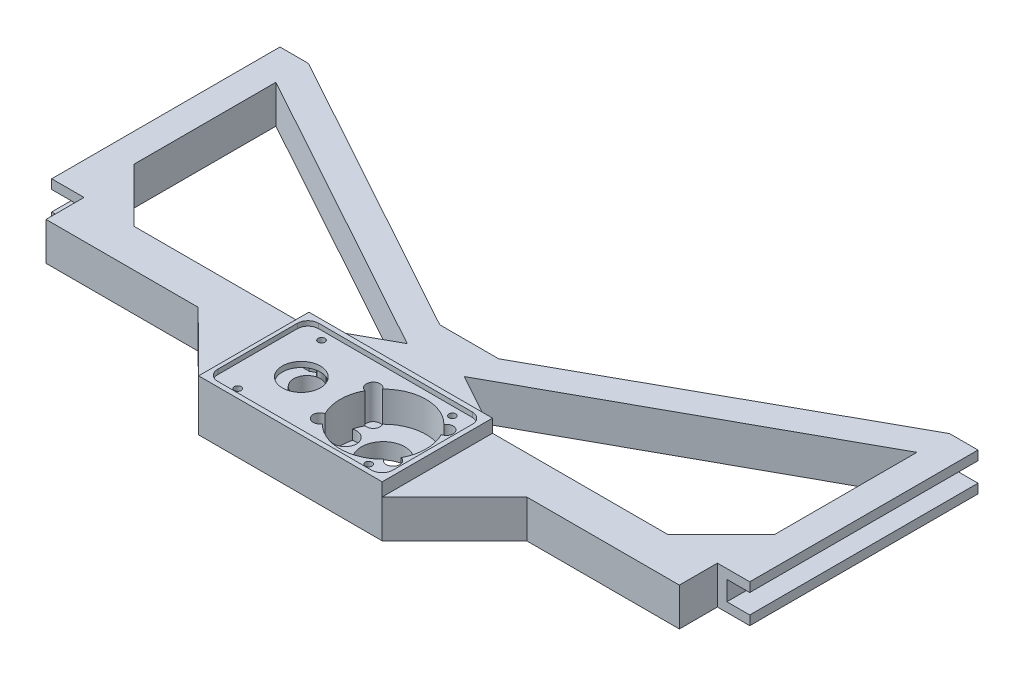
from build123d import *

# Parameters (mm, degrees)
BOSS_EXTRUDE1_DEPTH   = 12.7
CUT_EXTRUDE1_DEPTH    = 246.515176771
SKETCH3_W             = 7.62
SKETCH3_H             = 6.477
CUT_EXTRUDE2_DEPTH    = 246.515176771
SKETCH6_W             = 61.2775
SKETCH6_H             = 36.83
BOSS_EXTRUDE2_DEPTH   = 4.3815
CAVITY1_START         = 5.334
CAVITY1_OUTLINE_R     = 1.143
CAVITY1_OUTLINE_R_2   = 4.445
CAVITY1_DEPTH         = 11.7475
CAVITY1_START_2       = 15.494
CAVITY1_2_OUTLINE_R   = 1.143
CAVITY1_2_OUTLINE_R_2 = 4.445
CAVITY1_2_DEPTH       = 1.5875
CAVITY1_3_OUTLINE_R   = 1.143
CAVITY1_3_OUTLINE_R_2 = 7.239
CAVITY1_3_DEPTH       = 5.334
CAVITY1_START_3       = 2.286
CAVITY1_4_OUTLINE_R   = 4.445
CAVITY1_4_DEPTH       = 3.048
CAVITY1_START_4       = 13.716
CAVITY1_5_DEPTH       = 1.778
CAVITY1_6_OUTLINE_R   = 1.905
CAVITY1_6_OUTLINE_R_2 = 1.143
CAVITY1_6_DEPTH       = 3.302
CAVITY1_START_5       = 4.064
CAVITY1_7_OUTLINE_R   = 2.286
CAVITY1_7_DEPTH       = 1.27
CAVITY1_START_6       = 2.032
CAVITY1_8_DEPTH       = 0.254
SKETCH7_R             = 2.286
CUT_EXTRUDE4_DEPTH    = 10.795


# Read off the part's stored shape, not the designer's step: Cavity1
with BuildPart() as part:
    # Sketch1 → Boss-Extrude1 (new body)
    with BuildSketch(Plane(origin=(0, 0, 0), x_dir=(1, 0, 0), z_dir=(0, 1, 0))):
        Polygon((-233.045, 0), (-222.25, 0), (-222.25, -12.7), (-171.45, -12.7), (-147.16125, -36.83), (-85.88375, -36.83), (-61.595, -12.7), (-10.795, -12.7), (-10.795, 0), (0, 0), (0, 76.2), (-233.045, 76.2), align=None)
    extrude(amount=BOSS_EXTRUDE1_DEPTH)

    # Sketch2 → Cut-Extrude1 (cut, through all)
    with BuildSketch(Plane(origin=(0, 12.7, 0), x_dir=(1, 0, 0), z_dir=(0, 1, 0))):
        Polygon((-223.52, 76.2), (-9.525, 76.2), (-106.410006281, 22.561242197), (-126.0475, 22.561242197), align=None)
        Polygon((-223.52, 65.328031159), (-223.52, 17.960512242), (-205.559487758, 0), (-147.16125, 0), (-126.0475, 11.689273356), align=None)
        Polygon((-85.88375, 0), (-106.9975, 11.689273356), (-9.525, 65.328031159), (-9.525, 17.960512242), (-27.485512242, 0), align=None)
    extrude(amount=-CUT_EXTRUDE1_DEPTH, mode=Mode.SUBTRACT)

    # Sketch3 → Cut-Extrude2 (cut, through all)
    with BuildSketch(Plane.XY):
        with Locations((-229.235, 6.35)):
            Rectangle(SKETCH3_W, SKETCH3_H)
    cut_extrude2 = extrude(amount=-CUT_EXTRUDE2_DEPTH, mode=Mode.SUBTRACT)

    # Mirror1: Cut-Extrude2 across plane
    add(cut_extrude2.mirror(Plane.ZY.offset(116.5225)), mode=Mode.SUBTRACT)

    # Sketch6 → Boss-Extrude2 (add)
    with BuildSketch(Plane.XZ.offset(-12.7)):
        with Locations((-116.5225, 18.415)):
            Rectangle(SKETCH6_W, SKETCH6_H)
    extrude(amount=-BOSS_EXTRUDE2_DEPTH)

    # Cavity1 outline → Cavity1 (cut)
    with BuildSketch(Plane(origin=(0, 0, 0), x_dir=(1, 0, 0), z_dir=(0, 1, 0)).offset(CAVITY1_START)):
        with Locations((-138.52525, -4.445)):
            Circle(CAVITY1_OUTLINE_R)
        with Locations((-129.38125, -18.415)):
            Circle(CAVITY1_OUTLINE_R_2)
        with BuildLine():
            ThreePointArc((-116.691438518, -11.751494253), (-118.33225, -18.415), (-116.691438518, -25.078505747))
            ThreePointArc((-116.691438518, -25.078505747), (-118.020355214, -28.651847552), (-114.211817504, -28.479128852))
            ThreePointArc((-114.211817504, -28.479128852), (-103.98125, -32.766), (-93.750682496, -28.479128852))
            ThreePointArc((-93.750682496, -28.479128852), (-89.942144786, -28.651847552), (-91.271061482, -25.078505747))
            ThreePointArc((-91.271061482, -25.078505747), (-89.63025, -18.415), (-91.271061482, -11.751494253))
            ThreePointArc((-91.271061482, -11.751494253), (-89.942144786, -8.178152448), (-93.750682496, -8.350871148))
            ThreePointArc((-93.750682496, -8.350871148), (-103.98125, -4.064), (-114.211817504, -8.350871148))
            ThreePointArc((-114.211817504, -8.350871148), (-118.020355214, -8.178152448), (-116.691438518, -11.751494253))
        make_face()
        with Locations((-94.83725, -4.445)):
            Circle(CAVITY1_OUTLINE_R)
        with Locations((-138.52525, -32.385)):
            Circle(CAVITY1_OUTLINE_R)
        with Locations((-94.83725, -32.385)):
            Circle(CAVITY1_OUTLINE_R)
    extrude(amount=CAVITY1_DEPTH, mode=Mode.SUBTRACT)

    # Cavity1 2 outline → Cavity1 2 (cut)
    with BuildSketch(Plane(origin=(0, 0, 0), x_dir=(1, 0, 0), z_dir=(0, 1, 0)).offset(CAVITY1_START_2)):
        with BuildLine():
            ThreePointArc((-142.33525, -1.5875), (-144.849721714, -2.629028286), (-145.89125, -5.1435))
            Line((-145.89125, -5.1435), (-145.89125, -31.6865))
            ThreePointArc((-145.89125, -31.6865), (-144.849721714, -34.200971714), (-142.33525, -35.2425))
            Line((-142.33525, -35.2425), (-91.02725, -35.2425))
            ThreePointArc((-91.02725, -35.2425), (-88.512778286, -34.200971714), (-87.47125, -31.6865))
            Line((-87.47125, -31.6865), (-87.47125, -5.1435))
            ThreePointArc((-87.47125, -5.1435), (-88.512778286, -2.629028286), (-91.02725, -1.5875))
            Line((-91.02725, -1.5875), (-142.33525, -1.5875))
        make_face()
        with Locations((-138.52525, -4.445)):
            Circle(CAVITY1_2_OUTLINE_R, mode=Mode.SUBTRACT)
        with BuildLine():
            ThreePointArc((-114.211817504, -8.350871148), (-103.98125, -4.064), (-93.750682496, -8.350871148))
            ThreePointArc((-93.750682496, -8.350871148), (-89.942144786, -8.178152448), (-91.271061482, -11.751494253))
            ThreePointArc((-91.271061482, -11.751494253), (-89.63025, -18.415), (-91.271061482, -25.078505747))
            ThreePointArc((-91.271061482, -25.078505747), (-89.942144786, -28.651847552), (-93.750682496, -28.479128852))
            ThreePointArc((-93.750682496, -28.479128852), (-103.98125, -32.766), (-114.211817504, -28.479128852))
            ThreePointArc((-114.211817504, -28.479128852), (-118.020355214, -28.651847552), (-116.691438518, -25.078505747))
            ThreePointArc((-116.691438518, -25.078505747), (-118.33225, -18.415), (-116.691438518, -11.751494253))
            ThreePointArc((-116.691438518, -11.751494253), (-118.020355214, -8.178152448), (-114.211817504, -8.350871148))
        make_face(mode=Mode.SUBTRACT)
        with Locations((-129.38125, -18.415)):
            Circle(CAVITY1_2_OUTLINE_R_2, mode=Mode.SUBTRACT)
        with Locations((-94.83725, -4.445)):
            Circle(CAVITY1_2_OUTLINE_R, mode=Mode.SUBTRACT)
        with Locations((-138.52525, -32.385)):
            Circle(CAVITY1_2_OUTLINE_R, mode=Mode.SUBTRACT)
        with Locations((-94.83725, -32.385)):
            Circle(CAVITY1_2_OUTLINE_R, mode=Mode.SUBTRACT)
    extrude(amount=CAVITY1_2_DEPTH, mode=Mode.SUBTRACT)

    # Cavity1 3 outline → Cavity1 3 (cut)
    with BuildSketch(Plane(origin=(0, 0, 0), x_dir=(1, 0, 0), z_dir=(0, 1, 0))):
        with Locations((-138.52525, -4.445)):
            Circle(CAVITY1_3_OUTLINE_R)
        with Locations((-94.83725, -4.445)):
            Circle(CAVITY1_3_OUTLINE_R)
        with Locations((-138.52525, -32.385)):
            Circle(CAVITY1_3_OUTLINE_R)
        with Locations((-94.83725, -32.385)):
            Circle(CAVITY1_3_OUTLINE_R)
        with Locations((-103.98125, -18.415)):
            Circle(CAVITY1_3_OUTLINE_R_2)
    extrude(amount=CAVITY1_3_DEPTH, mode=Mode.SUBTRACT)

    # Cavity1 4 outline → Cavity1 4 (cut)
    with BuildSketch(Plane(origin=(0, 0, 0), x_dir=(1, 0, 0), z_dir=(0, 1, 0)).offset(CAVITY1_START_3)):
        with Locations((-129.38125, -18.415)):
            Circle(CAVITY1_4_OUTLINE_R)
        with BuildLine():
            ThreePointArc((-117.868065, -22.03543784), (-112.87125, -18.415), (-117.868065, -14.79456216))
            ThreePointArc((-117.868065, -14.79456216), (-118.33225, -18.415), (-117.868065, -22.03543784))
        make_face()
    extrude(amount=CAVITY1_4_DEPTH, mode=Mode.SUBTRACT)

    # Cavity1 5 outline → Cavity1 5 (cut)
    with BuildSketch(Plane(origin=(0, 0, 0), x_dir=(1, 0, 0), z_dir=(0, 1, 0)).offset(CAVITY1_START_4)):
        with BuildLine():
            Line((-128.370308668, -14.08648725), (-130.279975967, -12.145238237))
            ThreePointArc((-130.279975967, -12.145238237), (-134.269599777, -12.809455949), (-137.048919641, -15.747765737))
            Line((-137.048919641, -15.747765737), (-133.557318942, -16.89234666))
            ThreePointArc((-133.557318942, -16.89234666), (-131.4961306, -14.505357427), (-128.370308668, -14.08648725))
        make_face()
        with BuildLine():
            ThreePointArc((-125.062898336, -17.153099029), (-126.88891679, -13.833956381), (-130.279975967, -12.145238237))
            Line((-130.279975967, -12.145238237), (-128.370308668, -14.08648725))
            ThreePointArc((-128.370308668, -14.08648725), (-126.324912496, -15.187489185), (-125.114191907, -17.169913564))
            Line((-125.114191907, -17.169913564), (-125.062898336, -17.153099029))
        make_face()
        with BuildLine():
            ThreePointArc((-125.000827582, -17.511692175), (-125.02929351, -17.331950842), (-125.062898336, -17.153099029))
            Line((-125.062898336, -17.153099029), (-125.114191907, -17.169913564))
            ThreePointArc((-125.114191907, -17.169913564), (-125.072760846, -17.321864049), (-125.036738936, -17.475186925))
            Line((-125.036738936, -17.475186925), (-125.000827582, -17.511692175))
        make_face()
        with BuildLine():
            Line((-133.557318942, -16.89234666), (-137.048919641, -15.747765737))
            ThreePointArc((-137.048919641, -15.747765737), (-137.63625, -18.415), (-137.048919641, -21.082234263))
            Line((-137.048919641, -21.082234263), (-133.557318942, -19.93765334))
            ThreePointArc((-133.557318942, -19.93765334), (-133.82625, -18.415), (-133.557318942, -16.89234666))
        make_face()
        with BuildLine():
            ThreePointArc((-124.93625, -18.415), (-124.952414971, -17.962193393), (-125.000827582, -17.511692175))
            Line((-125.000827582, -17.511692175), (-125.036738936, -17.475186925))
            ThreePointArc((-125.036738936, -17.475186925), (-124.961443631, -17.942414917), (-124.93625, -18.415))
        make_face()
        with BuildLine():
            Line((-133.557318942, -19.93765334), (-137.048919641, -21.082234263))
            ThreePointArc((-137.048919641, -21.082234263), (-134.269599777, -24.020544051), (-130.279975966, -24.684761763))
            Line((-130.279975966, -24.684761763), (-128.370308667, -22.743512749))
            ThreePointArc((-128.370308667, -22.743512749), (-131.4961306, -22.324642573), (-133.557318942, -19.93765334))
        make_face()
        with BuildLine():
            ThreePointArc((-125.000827582, -19.318307826), (-124.952414971, -18.867806607), (-124.93625, -18.415))
            ThreePointArc((-124.93625, -18.415), (-124.961443631, -18.887585083), (-125.036738936, -19.354813075))
            Line((-125.036738936, -19.354813075), (-125.000827582, -19.318307826))
        make_face()
        with BuildLine():
            Line((-128.370308667, -22.743512749), (-130.279975966, -24.684761763))
            ThreePointArc((-130.279975966, -24.684761763), (-126.88891679, -22.996043619), (-125.062898336, -19.676900971))
            Line((-125.062898336, -19.676900971), (-125.114191907, -19.660086436))
            ThreePointArc((-125.114191907, -19.660086436), (-126.324912495, -21.642510815), (-128.370308667, -22.743512749))
        make_face()
        with BuildLine():
            ThreePointArc((-125.062898336, -19.676900971), (-125.02929351, -19.498049158), (-125.000827582, -19.318307826))
            Line((-125.000827582, -19.318307826), (-125.036738936, -19.354813075))
            ThreePointArc((-125.036738936, -19.354813075), (-125.072760846, -19.508135952), (-125.114191907, -19.660086436))
            Line((-125.114191907, -19.660086436), (-125.062898336, -19.676900971))
        make_face()
    extrude(amount=CAVITY1_5_DEPTH, mode=Mode.SUBTRACT)

    # Cavity1 6 outline → Cavity1 6 (cut)
    # profile 1 of 4: a face of its own
    with BuildSketch(Plane(origin=(0, 0, 0), x_dir=(1, 0, 0), z_dir=(0, 1, 0))):
        with Locations((-138.52525, -4.445)):
            Circle(CAVITY1_6_OUTLINE_R)
        with Locations((-138.52525, -4.445)):
            Circle(CAVITY1_6_OUTLINE_R_2, mode=Mode.SUBTRACT)
    # profile 2 of 4: a face of its own
    with BuildSketch(Plane(origin=(0, 0, 0), x_dir=(1, 0, 0), z_dir=(0, 1, 0))):
        with Locations((-94.83725, -4.445)):
            Circle(CAVITY1_6_OUTLINE_R)
        with Locations((-94.83725, -4.445)):
            Circle(CAVITY1_6_OUTLINE_R_2, mode=Mode.SUBTRACT)
    # profile 3 of 4: a face of its own
    with BuildSketch(Plane(origin=(0, 0, 0), x_dir=(1, 0, 0), z_dir=(0, 1, 0))):
        with Locations((-138.52525, -32.385)):
            Circle(CAVITY1_6_OUTLINE_R)
        with Locations((-138.52525, -32.385)):
            Circle(CAVITY1_6_OUTLINE_R_2, mode=Mode.SUBTRACT)
    # profile 4 of 4: a face of its own
    with BuildSketch(Plane(origin=(0, 0, 0), x_dir=(1, 0, 0), z_dir=(0, 1, 0))):
        with Locations((-94.83725, -32.385)):
            Circle(CAVITY1_6_OUTLINE_R)
        with Locations((-94.83725, -32.385)):
            Circle(CAVITY1_6_OUTLINE_R_2, mode=Mode.SUBTRACT)
    extrude(amount=CAVITY1_6_DEPTH, mode=Mode.SUBTRACT)

    # Cavity1 7 outline → Cavity1 7 (cut)
    with BuildSketch(Plane(origin=(0, 0, 0), x_dir=(1, 0, 0), z_dir=(0, 1, 0)).offset(CAVITY1_START_5)):
        with Locations((-116.17325, -9.525)):
            Circle(CAVITY1_7_OUTLINE_R)
        with Locations((-91.78925, -9.525)):
            Circle(CAVITY1_7_OUTLINE_R)
        with Locations((-116.17325, -27.305)):
            Circle(CAVITY1_7_OUTLINE_R)
        with Locations((-91.78925, -27.305)):
            Circle(CAVITY1_7_OUTLINE_R)
    extrude(amount=CAVITY1_7_DEPTH, mode=Mode.SUBTRACT)

    # Cavity1 8 outline → Cavity1 8 (cut)
    with BuildSketch(Plane(origin=(0, 0, 0), x_dir=(1, 0, 0), z_dir=(0, 1, 0)).offset(CAVITY1_START_6)):
        with BuildLine():
            ThreePointArc((-117.868065, -22.03543784), (-112.87125, -18.415), (-117.868065, -14.79456216))
            ThreePointArc((-117.868065, -14.79456216), (-118.33225, -18.415), (-117.868065, -22.03543784))
        make_face()
    extrude(amount=CAVITY1_8_DEPTH, mode=Mode.SUBTRACT)

    # Sketch7 → Cut-Extrude4 (cut)
    with BuildSketch(Plane.XZ):
        with Locations(Location((-103.8225, -0.635, 0), (0, 0, 270))):
            Circle(SKETCH7_R)
        with Locations(Location((-129.2225, -0.635, 0), (0, 0, 270))):
            Circle(SKETCH7_R)
    extrude(amount=-CUT_EXTRUDE4_DEPTH, mode=Mode.SUBTRACT)


solid = part.part
